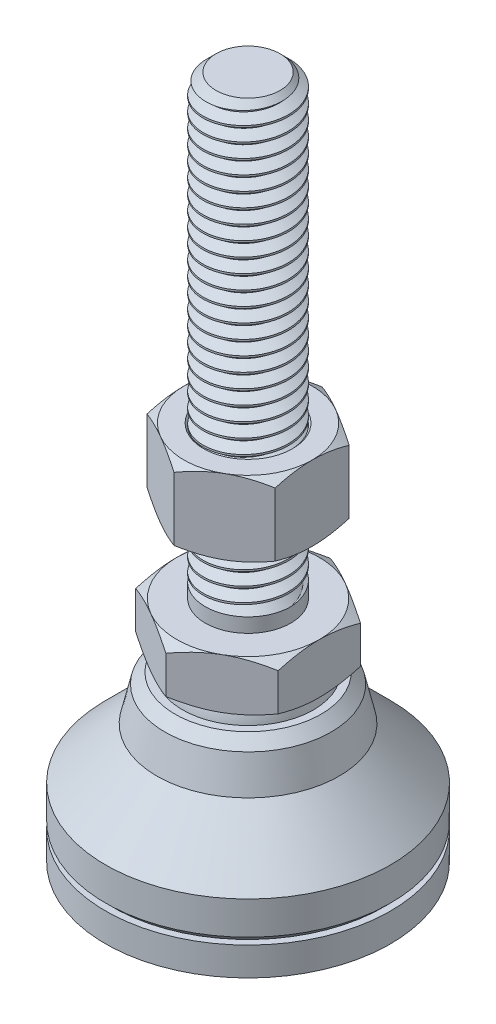
from build123d import *
from build123d.topology import SkipClean

# Parameters (mm, degrees)
BOSS_EXTRUDE1_DEPTH = 5.588
SKETCH6_R           = 4.7625
BOSS_EXTRUDE2_DEPTH = 50.8
CUT_SWEEP1_PITCH    = 1.5875
CUT_SWEEP1_TO       = 50.8
SKETCH9_OUTSIDE_W   = 152.496
SKETCH9_OUTSIDE_H   = 152.496
SKETCH9_OUTSIDE_R   = 3.559536588
CUT_EXTRUDE1_DEPTH  = 50.8
CUT_EXTRUDE1_DRAFT  = -45
SKETCH10_R          = 4.7625
BOSS_EXTRUDE3_DEPTH = 8.334375
SKETCH14_W          = 15.875
SKETCH14_H          = 3.175


with BuildPart() as part:
    # Sketch2 → Revolve1 (revolve)
    with BuildSketch(Plane.XY, mode=Mode.PRIVATE) as revolve1_sk:
        with BuildLine():
            Line((0, 3.175), (0, 9.7663))
            ThreePointArc((0, 9.7663), (-5.607096744, 12.348576354), (-7.289634057, 18.288))
            Line((-7.289634057, 18.288), (-8.128, 18.288))
            Line((-8.128, 18.288), (-9.271, 17.145))
            Line((-9.271, 17.145), (-10.16, 13.335))
            Line((-10.16, 13.335), (-15.875, 7.62))
            Line((-15.875, 7.62), (-15.875, 3.937))
            Line((-15.875, 3.937), (-15.113, 3.175))
            Line((-15.113, 3.175), (0, 3.175))
        make_face()
    revolve(revolve1_sk.sketch.rotate(Axis((0, 0, 0), (0, 1, 0)), 270), axis=Axis((0, 0, 0), (0, 1, 0)))


with BuildPart() as body_2:
    # Sketch12 → Revolve2 (revolve)
    with BuildSketch(Plane.XY, mode=Mode.PRIVATE) as revolve2_sk:
        with BuildLine():
            Line((0, 19.812), (-6.879849176, 19.812))
            ThreePointArc((-6.879849176, 19.812), (-6.087865249, 12.975694255), (0, 9.7663))
            Line((0, 9.7663), (0, 19.812))
        make_face()
    revolve(revolve2_sk.sketch.rotate(Axis((0, 19.812, 0), (0, -1, 0)), 180), axis=Axis((0, 19.812, 0), (0, -1, 0)))

    # Sketch4 → Boss-Extrude1 (add)
    with BuildSketch(Plane(origin=(0, 19.812, 0), x_dir=(1, 0, 0), z_dir=(0, 1, 0))):
        Polygon((0, 9.165435523), (-7.9375, 4.582717762), (-7.9375, -4.582717762), (0, -9.165435523), (7.9375, -4.582717762), (7.9375, 4.582717762), align=None)
    extrude(amount=BOSS_EXTRUDE1_DEPTH)

    # Sketch5 → Cut-Revolve2 (revolve, cut)
    with BuildSketch(Plane(origin=(0, 0, 0), x_dir=(0, 0, -1), z_dir=(1, 0, 0)), mode=Mode.PRIVATE) as cut_revolve2_sk:
        Polygon((-10.393371047, 25.4), (-10.393371047, 19.812), (-7.9375, 19.812), (-9.165435523, 20.520948905), (-9.165435523, 24.691051095), (-7.9375, 25.4), align=None)
    revolve(cut_revolve2_sk.sketch.rotate(Axis((0, 0, 0), (0, 1, 0)), 90), axis=Axis((0, 0, 0), (0, 1, 0)), mode=Mode.SUBTRACT)


with BuildPart() as body_3:
    # Sketch6 → Boss-Extrude2 (new body)
    with BuildSketch(Plane(origin=(0, 25.4, 0), x_dir=(1, 0, 0), z_dir=(0, 1, 0))):
        with Locations(Location((0, 0, 0), (0, 0, 270))):
            Circle(SKETCH6_R)
    extrude(amount=BOSS_EXTRUDE2_DEPTH)

    # Cut-Sweep1: arcs per turn and ends read off the stored shape
    # Cut-Sweep1: the profile of Sketch8 screwed along a right-hand helix through 34 turns, 8 arcs to a turn; built about Z, then put on its axis
    cut_sweep1_z = Axis((0, 0, 0), (0, 0, 1))
    cut_sweep1_corners = [(4.848425958, 0, -3.026171875), (3.731388504, 0, -2.38125), (3.731388504, 0, -2.1828125), (4.848425958, 0, -1.537890625)]
    with BuildLine(mode=Mode.PRIVATE) as cut_sweep1_profile:
        Line(cut_sweep1_corners[0], cut_sweep1_corners[1])
        Line(cut_sweep1_corners[1], cut_sweep1_corners[2])
        Line(cut_sweep1_corners[2], cut_sweep1_corners[3])
        Line(cut_sweep1_corners[3], cut_sweep1_corners[0])
    cut_sweep1_cap = Face(cut_sweep1_profile.wire())
    cut_sweep1_turn_angles = [0, 22.5, 45, 67.5, 90, 112.5, 135, 157.5, 180, 202.5, 225, 247.5, 270, 292.5, 315, 337.5, 360]
    cut_sweep1_turn_weights = [1, 0.9238795325112867, 1, 0.9238795325112867, 1, 0.9238795325112867, 1, 0.9238795325112867, 1, 0.9238795325112867, 1, 0.9238795325112867, 1, 0.9238795325112867, 1, 0.9238795325112867, 1]
    cut_sweep1_turn_rails = [Edge.make_bspline([Vector(p[0], p[1], 0).rotate(cut_sweep1_z, cut_sweep1_turn_angles[k]) / cut_sweep1_turn_weights[k] + Vector(0, 0, p[2] + CUT_SWEEP1_PITCH * cut_sweep1_turn_angles[k] / 360) for k in range(17)], [0, 0, 0, 1, 1, 2, 2, 3, 3, 4, 4, 5, 5, 6, 6, 7, 7, 8, 8, 8], 2, cut_sweep1_turn_weights) for p in cut_sweep1_corners]
    cut_sweep1_turn_sides = [Face.make_surface_from_curves(cut_sweep1_turn_rails[p[0]], cut_sweep1_turn_rails[p[1]]) for p in [(0, 1), (1, 2), (2, 3), (3, 0)]]
    cut_sweep1 = Plane(origin=(0, 76.2, 0), x_dir=(1, 0, 0), z_dir=(0, -1, 0)) * split(Solid(Shell([*[p.moved(Location((0, 0, CUT_SWEEP1_PITCH * i))) for i in range(34) for p in cut_sweep1_turn_sides], cut_sweep1_cap, cut_sweep1_cap.rotate(cut_sweep1_z, 12240).moved(Location((0, 0, CUT_SWEEP1_PITCH * 12240 / 360)))])), bisect_by=Plane.XY.offset(CUT_SWEEP1_TO), keep=Keep.BOTTOM, mode=Mode.PRIVATE)
    add(cut_sweep1, mode=Mode.SUBTRACT)


with BuildPart() as cut_extrude1_tool:
    # Sketch9 outside → Cut-Extrude1 (with draft: the straight prism first)
    with BuildSketch(Plane(origin=(0, 76.2, 0), x_dir=(1, 0, 0), z_dir=(0, 1, 0))):
        Rectangle(SKETCH9_OUTSIDE_W, SKETCH9_OUTSIDE_H)
        Circle(SKETCH9_OUTSIDE_R, mode=Mode.SUBTRACT)
    extrude(amount=-CUT_EXTRUDE1_DEPTH)
    # Cut-Extrude1: the draft: its side faces are tilted about the plane it starts from
    cut_extrude1_sides = [cut_extrude1_tool.faces().sort_by_distance(p)[0] for p in [
        (0, 50.8, 76.248),
        (76.248, 50.8, 0),
        (0, 50.8, -76.248),
        (-76.248, 50.8, 0),
        (-3.559536588, 50.8, 0),
    ]]
    draft(cut_extrude1_sides, Plane(origin=(0, 76.2, 0), x_dir=(1, 0, 0), z_dir=(0, 1, 0)), CUT_EXTRUDE1_DRAFT)


with BuildPart() as body_3_1:
    add(body_3.part)

    # Cut-Extrude1: cut by cut_extrude1_tool
    add(cut_extrude1_tool.part, mode=Mode.SUBTRACT)

    # Combine1: union body 2
    add(body_2.part)

    # Sketch13 → Revolve3 (revolve)
    with SkipClean():  # the faces are left unmerged after this step: merging them gives an invalid solid
        with BuildSketch(Plane.XY, mode=Mode.PRIVATE) as revolve3_sk:
            Polygon((0, 31.75), (4.7625, 26.9875), (4.7625, 25.4), (0, 25.4), align=None)
        revolve(revolve3_sk.sketch.rotate(Axis((0, 31.75, 0), (0, -1, 0)), 272.921710335), axis=Axis((0, 31.75, 0), (0, -1, 0)))


with BuildPart() as body_3_2:
    # Sketch10 → Boss-Extrude3 (new body)
    with BuildSketch(Plane(origin=(0, 42.333333333, 0), x_dir=(-1, 0, 0), z_dir=(0, 1, 0))):
        Polygon((0, 8.248891971), (-7.14375, 4.124445986), (-7.14375, -4.124445986), (0, -8.248891971), (7.14375, -4.124445986), (7.14375, 4.124445986), align=None)
        with Locations(Location((0, 0, 0), (0, 0, 90))):
            Circle(SKETCH10_R, mode=Mode.SUBTRACT)
    extrude(amount=-BOSS_EXTRUDE3_DEPTH)

    # Sketch11 → Cut-Revolve3 (revolve, cut)
    with BuildSketch(Plane(origin=(0, 0, 0), x_dir=(0, 0, -1), z_dir=(1, 0, 0)), mode=Mode.PRIVATE) as cut_revolve3_sk:
        Polygon((-9.354033942, 33.998958333), (-9.354033942, 42.333333333), (-7.14375, 42.333333333), (-8.248891971, 41.695279319), (-8.248891971, 34.637012348), (-7.14375, 33.998958333), align=None)
        Polygon((0, 33.998958333), (0, 42.333333333), (4.9609375, 42.333333333), (4.7625, 42.134895833), (4.7625, 34.197395833), (4.9609375, 33.998958333), align=None)
    revolve(cut_revolve3_sk.sketch.rotate(Axis((0, 0, 0), (0, 1, 0)), 180), axis=Axis((0, 0, 0), (0, 1, 0)), mode=Mode.SUBTRACT)


with BuildPart() as body_4:
    # Sketch14 → Revolve4 (revolve)
    with BuildSketch(Plane.XY, mode=Mode.PRIVATE) as revolve4_sk:
        with Locations((7.9375, 1.5875)):
            Rectangle(SKETCH14_W, SKETCH14_H)
    revolve(revolve4_sk.sketch.rotate(Axis((0, 0, 0), (0, 1, 0)), 87.078289665), axis=Axis((0, 0, 0), (0, 1, 0)))


solid = Compound([part.part, body_3_1.part, body_3_2.part, body_4.part])
